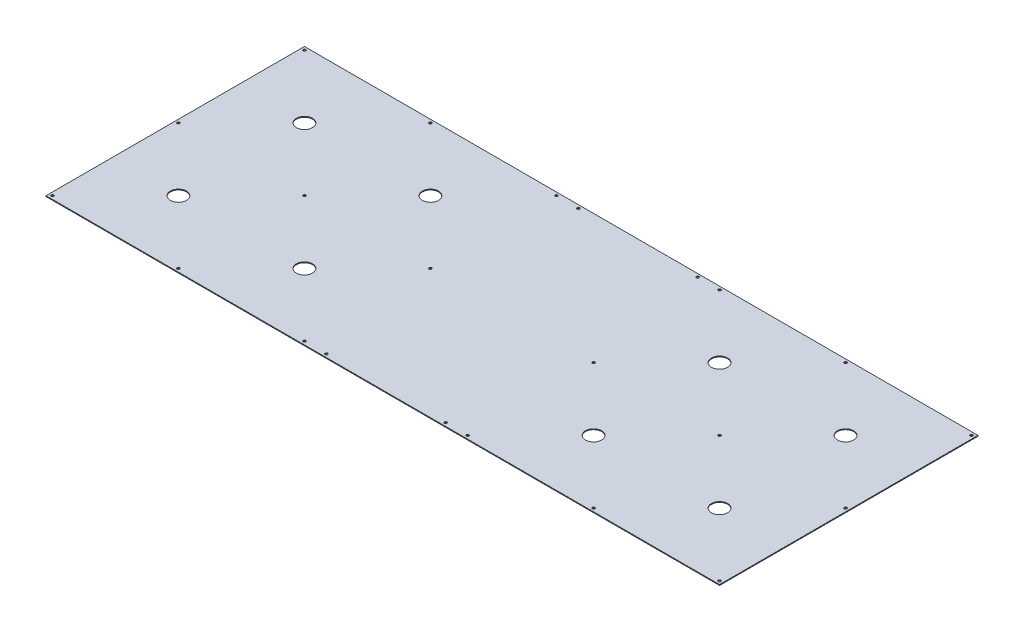
from build123d import *

# Parameters (mm, degrees)
MAIN_PLATE_W        = 834
MAIN_PLATE_H        = 320
BOSS_EXTRUDE1_DEPTH = 1.016
MAIN_HOLES_R        = 1.6
CUT_EXTRUDE1_DEPTH  = 447.64307031
SMA_R               = 10
CUT_EXTRUDE2_DEPTH  = 447.64307031


with BuildPart() as part:
    # main_plate → Boss-Extrude1 (new body)
    with BuildSketch(Plane(origin=(0, 0, 0), x_dir=(1, 0, 0), z_dir=(0, 1, 0))):
        Rectangle(MAIN_PLATE_W, MAIN_PLATE_H)
    extrude(amount=BOSS_EXTRUDE1_DEPTH)

    # main_holes → Cut-Extrude1 (cut, through all)
    with BuildSketch(Plane(origin=(0, 1.016, 0), x_dir=(1, 0, 0), z_dir=(0, 1, 0))):
        with Locations((-413, 156)):
            Circle(MAIN_HOLES_R)
        with Locations((-257, 156)):
            Circle(MAIN_HOLES_R)
        with Locations((-101, 156)):
            Circle(MAIN_HOLES_R)
        with Locations((-257, 0)):
            Circle(MAIN_HOLES_R)
        with Locations((-101, 0)):
            Circle(MAIN_HOLES_R)
        with Locations((-257, -156)):
            Circle(MAIN_HOLES_R)
        with Locations((-101, -156)):
            Circle(MAIN_HOLES_R)
        with Locations((-413, 0)):
            Circle(MAIN_HOLES_R)
        with Locations((-413, -156)):
            Circle(MAIN_HOLES_R)
        with Locations((413, -156)):
            Circle(MAIN_HOLES_R)
        with Locations((413, 0)):
            Circle(MAIN_HOLES_R)
        with Locations((101, -156)):
            Circle(MAIN_HOLES_R)
        with Locations((257, -156)):
            Circle(MAIN_HOLES_R)
        with Locations((101, 0)):
            Circle(MAIN_HOLES_R)
        with Locations((257, 0)):
            Circle(MAIN_HOLES_R)
        with Locations((101, 156)):
            Circle(MAIN_HOLES_R)
        with Locations((257, 156)):
            Circle(MAIN_HOLES_R)
        with Locations((413, 156)):
            Circle(MAIN_HOLES_R)
        with Locations((-73.81875, 156)):
            Circle(MAIN_HOLES_R)
        with Locations((73.81875, 156)):
            Circle(MAIN_HOLES_R)
        with Locations((73.81875, -156)):
            Circle(MAIN_HOLES_R)
        with Locations((-73.81875, -156)):
            Circle(MAIN_HOLES_R)
    extrude(amount=-CUT_EXTRUDE1_DEPTH, mode=Mode.SUBTRACT)

    # sma → Cut-Extrude2 (cut, through all)
    with BuildSketch(Plane(origin=(0, 1.016, 0), x_dir=(1, 0, 0), z_dir=(0, 1, 0))):
        with Locations((-335, 78)):
            Circle(SMA_R)
        with Locations((-179, 78)):
            Circle(SMA_R)
        with Locations((-179, -78)):
            Circle(SMA_R)
        with Locations((-335, -78)):
            Circle(SMA_R)
        with Locations((335, 78)):
            Circle(SMA_R)
        with Locations((179, 78)):
            Circle(SMA_R)
        with Locations((335, -78)):
            Circle(SMA_R)
        with Locations((179, -78)):
            Circle(SMA_R)
    extrude(amount=-CUT_EXTRUDE2_DEPTH, mode=Mode.SUBTRACT)


solid = part.part
